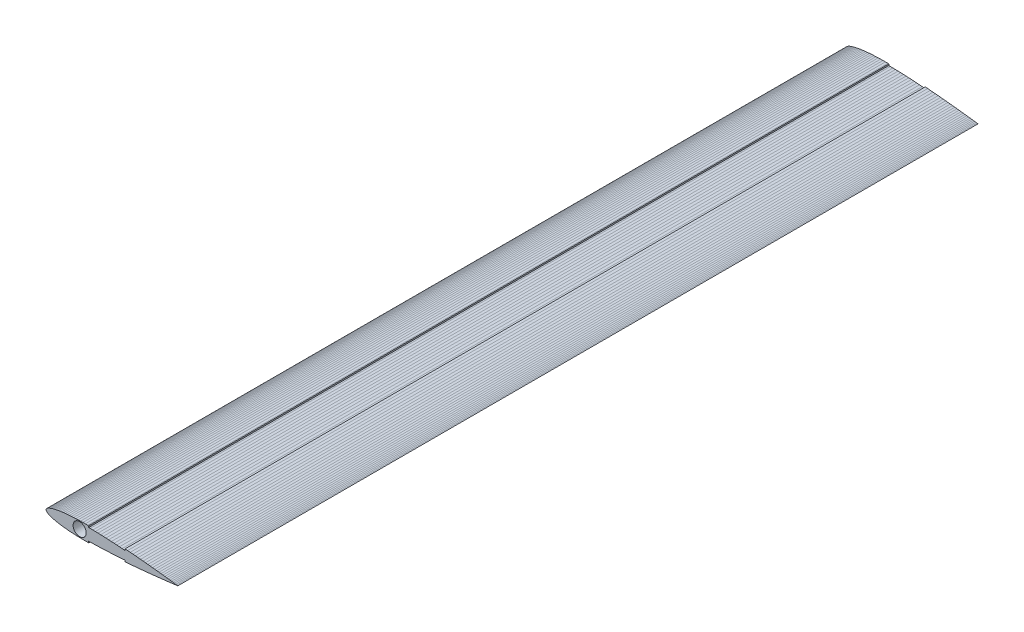
from build123d import *

# Parameters (mm, degrees)
DEFINED_MATERIAL_SECTION_L220_DEPTH = 220
SKETCH2_R                           = 1.8
SPAR_BOND_CHANNEL_D3P6_DEPTH        = 220.01
COMBINE1_DEPTH                      = 220
COMBINE2_DEPTH                      = 220


# Read off the part's stored shape, not the designer's step: Combine1, Combine2
with BuildPart() as part:
    # Sketch1 → Defined_Material_Section_L220 (new body)
    with BuildSketch(Plane.XY):
        Polygon((0.260120577, -0.077209757), (0.287474145, -0.15786929), (0.338114671, -0.245917092), (0.416559552, -0.341584601), (0.525444603, -0.442905894), (0.665656609, -0.547497871), (0.837076908, -0.653347356), (1.039144933, -0.758943249), (1.271148724, -0.863182622), (1.532345731, -0.965248051), (1.822002601, -1.064511663), (2.139401632, -1.160470454), (2.483835507, -1.252705336), (2.854599169, -1.340856038), (3.250982088, -1.424606162), (3.672261904, -1.503674571), (4.117699579, -1.577810715), (4.586535851, -1.64679238), (5.077988773, -1.710424865), (5.591252096, -1.768540996), (6.12549432, -1.821001536), (6.679858269, -1.867695748), (7.253461065, -1.908541913), (7.845394428, -1.943487689), (8.454725236, -1.972510239), (9.080496293, -1.995616069), (9.72172726, -2.012840572), (10.37741574, -2.024247252), (11.046538473, -2.029926643), (11.72805263, -2.029994951), (12.420897198, -2.024592435), (13.123994434, -2.013881565), (13.836251383, -1.998044999), (14.556561449, -1.977283418), (15.28380601, -1.951813275), (16.016856081, -1.921864485), (16.754574, -1.887678119), (17.495815146, -1.849504144), (18.239429685, -1.807599235), (18.984264321, -1.762224717), (19.729164078, -1.713644652), (20.472974075, -1.662124111), (21.214541315, -1.60792765), (21.952716474, -1.55131799), (22.686355686, -1.492554942), (23.414322318, -1.431894547), (24.135488745, -1.369588447), (24.8487381, -1.30588347), (25.552966014, -1.241021418), (26.247082334, -1.175239036), (26.930012818, -1.108768136), (27.600700802, -1.041835852), (28.258108836, -0.974664996), (28.901220296, -0.907474478), (29.529040949, -0.840479762), (30.140600489, -0.773893327), (30.734954029, -0.707925094), (31.311183552, -0.642782802), (31.868399314, -0.57867229), (32.405741208, -0.515797679), (32.922380068, -0.454361422), (33.417518931, -0.394564212), (33.890394244, -0.336604745), (34.340277016, -0.280679314), (34.766473917, -0.226981264), (35.168328319, -0.175700281), (35.545221277, -0.127021559), (35.896572459, -0.081124824), (36.221841003, -0.038183271), (36.508243213, 0), (36.221841003, 0.038183271), (35.896572459, 0.081124824), (35.545221277, 0.127021559), (35.168328319, 0.175700281), (34.766473917, 0.226981264), (34.340277016, 0.280679314), (33.890394244, 0.336604745), (33.417518931, 0.394564212), (32.922380068, 0.454361422), (32.405741208, 0.515797679), (31.868399314, 0.57867229), (31.311183552, 0.642782802), (30.734954029, 0.707925094), (30.140600489, 0.773893327), (29.529040949, 0.840479762), (28.901220296, 0.907474478), (28.258108836, 0.974664996), (27.600700802, 1.041835852), (26.930012818, 1.108768136), (26.247082334, 1.175239036), (25.552966014, 1.241021418), (24.8487381, 1.30588347), (24.135488745, 1.369588447), (23.414322318, 1.431894547), (22.686355686, 1.492554942), (21.952716474, 1.55131799), (21.214541315, 1.60792765), (20.472974075, 1.662124111), (19.729164078, 1.713644652), (18.984264321, 1.762224717), (18.239429685, 1.807599235), (17.495815146, 1.849504144), (16.754574, 1.887678119), (16.016856081, 1.921864485), (15.28380601, 1.951813275), (14.556561449, 1.977283418), (13.836251383, 1.998044999), (13.123994434, 2.013881565), (12.420897198, 2.024592435), (11.72805263, 2.029994951), (11.046538473, 2.029926643), (10.37741574, 2.024247252), (9.72172726, 2.012840572), (9.080496293, 1.995616069), (8.454725236, 1.972510239), (7.845394428, 1.943487689), (7.253461065, 1.908541913), (6.679858269, 1.867695748), (6.12549432, 1.821001536), (5.591252096, 1.768540996), (5.077988773, 1.710424865), (4.586535851, 1.64679238), (4.117699579, 1.577810715), (3.672261904, 1.503674571), (3.250982088, 1.424606162), (2.854599169, 1.340856038), (2.483835507, 1.252705336), (2.139401632, 1.160470454), (1.822002601, 1.064511663), (1.532345731, 0.965248051), (1.271148724, 0.863182622), (1.039144933, 0.758943249), (0.837076908, 0.653347356), (0.665656609, 0.547497871), (0.525444603, 0.442905894), (0.416559552, 0.341584601), (0.338114671, 0.245917092), (0.287474145, 0.15786929), (0.260120577, 0.077209757), (0.251539329, 0), align=None)
    extrude(amount=DEFINED_MATERIAL_SECTION_L220_DEPTH)

    # Sketch2 → Spar_Bond_Channel_D3p6 (cut)
    with BuildSketch(Plane(origin=(0, 0, 0), x_dir=(-1, 0, 0), z_dir=(0, 0, -1))):
        with Locations((-9.5, 0)):
            Circle(SKETCH2_R)
    extrude(amount=-SPAR_BOND_CHANNEL_D3P6_DEPTH, mode=Mode.SUBTRACT)

    # Combine1 outline → Combine1 (cut)
    with BuildSketch(Plane.XY):
        Polygon((12, 2.027874417), (12, 1.627862257), (12.41629125, 1.62461619), (13.116502158, 1.61394929), (13.826043272, 1.598173108), (14.543798827, 1.577485157), (15.268641415, 1.552099138), (15.999433548, 1.522242595), (16.735029283, 1.488154573), (17.474275891, 1.450083317), (18.216015579, 1.408284062), (18.959087234, 1.363016942), (19.702328203, 1.314545058), (20.444576084, 1.263132719), (21.184670536, 1.209043894), (21.921455096, 1.152540877), (22, 1.146249586), (22, 1.547530673), (21.952716474, 1.55131799), (21.214541315, 1.60792765), (20.472974075, 1.662124111), (19.729164078, 1.713644652), (18.984264321, 1.762224717), (18.239429685, 1.807599235), (17.495815146, 1.849504144), (16.754574, 1.887678119), (16.016856081, 1.921864485), (15.28380601, 1.951813275), (14.556561449, 1.977283418), (13.836251383, 1.998044999), (13.123994434, 2.013881565), (12.420897198, 2.024592435), align=None)
    extrude(amount=COMBINE1_DEPTH, mode=Mode.SUBTRACT)

    # Combine2 outline → Combine2 (cut)
    with BuildSketch(Plane.XY):
        Polygon((12, -1.627862257), (12, -2.027874417), (12.420897198, -2.024592435), (13.123994434, -2.013881565), (13.836251383, -1.998044999), (14.556561449, -1.977283418), (15.28380601, -1.951813275), (16.016856081, -1.921864485), (16.754574, -1.887678119), (17.495815146, -1.849504144), (18.239429685, -1.807599235), (18.984264321, -1.762224717), (19.729164078, -1.713644652), (20.472974075, -1.662124111), (21.214541315, -1.60792765), (21.952716474, -1.55131799), (22, -1.547530673), (22, -1.146249586), (21.921455096, -1.152540877), (21.184670536, -1.209043894), (20.444576084, -1.263132719), (19.702328203, -1.314545058), (18.959087234, -1.363016942), (18.216015579, -1.408284062), (17.474275891, -1.450083317), (16.735029283, -1.488154573), (15.999433548, -1.522242595), (15.268641415, -1.552099138), (14.543798827, -1.577485157), (13.826043272, -1.598173108), (13.116502158, -1.61394929), (12.41629125, -1.62461619), align=None)
    extrude(amount=COMBINE2_DEPTH, mode=Mode.SUBTRACT)


solid = part.part
